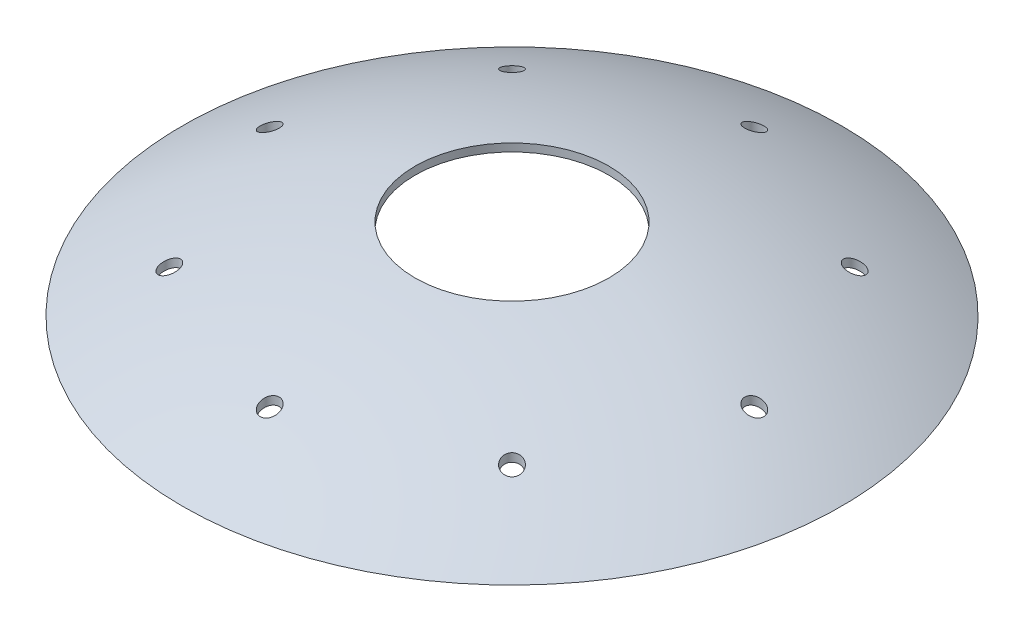
from build123d import *

# Parameters (mm, degrees)
SKETCH4_R          = 25
CUT_EXTRUDE1_DEPTH = 28.733611115
SKETCH5_R          = 2.45
CUT_EXTRUDE2_DEPTH = 32


# Read off the part's stored shape, not the designer's step: Shell4
with BuildPart() as part:
    # Sketch2 → Revolve3 (revolve)
    with BuildSketch(Plane.XY):
        with BuildLine():
            ThreePointArc((-85, 0), (-44.035124249, 17.090049267), (0, 22.666666667))
            Line((0, 22.666666667), (0, 0))
            Line((0, 0), (-85, 0))
        make_face()
    revolve(axis=Axis((0, 22.666666667, 0), (0, -1, 0)))

    # Shell4 outline → Shell4 (revolve, cut)
    with BuildSketch(Plane.XY):
        with BuildLine():
            Line((0, 0), (80.969632734, 0))
            add(Edge.make_bspline(
                [(80.969632734, 0), (66.621841833, 7.998750525), (51.021590529, 14.330573545), (34.596464201, 18.602407996), (17.8775717, 20.672871133), (1.145729943, 20.672871078), (0.859172221, 20.672242335), (0.572696188, 20.670985542), (0.286304549, 20.669101416), (0, 20.666590696)],
                knots=[1.062220798, 1.062220798, 1.062220798, 1.062220798, 1.062220798, 1.062220798, 1.570702766, 1.570702766, 1.570702766, 1.570702766, 1.579565507, 1.579565507, 1.579565507, 1.579565507, 1.579565507, 1.579565507], degree=5, weights=[1, 1, 0.999586847, 0.99958592, 1, 1, 1, 1, 1, 1]))
            Line((0, 20.666590696), (0, 0))
        make_face()
    revolve(axis=Axis((0, 0, 0), (0, 1, 0)), mode=Mode.SUBTRACT)

    # Sketch4 → Cut-Extrude1 (cut)
    with BuildSketch(Plane(origin=(0, 0, 0), x_dir=(1, 0, 0), z_dir=(0, 1, 0))):
        with Locations(Location((0, 0, 0), (0, 0, 90))):
            Circle(SKETCH4_R)
    extrude(amount=CUT_EXTRUDE1_DEPTH, mode=Mode.SUBTRACT)

    # Sketch5 → Cut-Extrude2 (cut)
    with BuildSketch(Plane(origin=(0, 0, 0), x_dir=(1, 0, 0), z_dir=(0, 1, 0))):
        with Locations(Location((0, 62.5, 0), (0, 0, 124.491275256))):
            Circle(SKETCH5_R)
        with Locations(Location((44.194173824, 44.194173824, 0), (0, 0, 125.680341575))):
            Circle(SKETCH5_R)
        with Locations(Location((62.5, 0, 0), (0, 0, 123.246694424))):
            Circle(SKETCH5_R)
        with Locations(Location((44.194173824, -44.194173824, 0), (0, 0, 135))):
            Circle(SKETCH5_R)
        with Locations(Location((0, -62.5, 0), (0, 0, 90))):
            Circle(SKETCH5_R)
        with Locations(Location((-44.194173824, -44.194173824, 0), (0, 0, 139.185402204))):
            Circle(SKETCH5_R)
        with Locations(Location((-62.5, 0, 0), (0, 0, 133.887830403))):
            Circle(SKETCH5_R)
        with Locations(Location((-44.194173824, 44.194173824, 0), (0, 0, 135))):
            Circle(SKETCH5_R)
    extrude(amount=CUT_EXTRUDE2_DEPTH, mode=Mode.SUBTRACT)


solid = part.part
